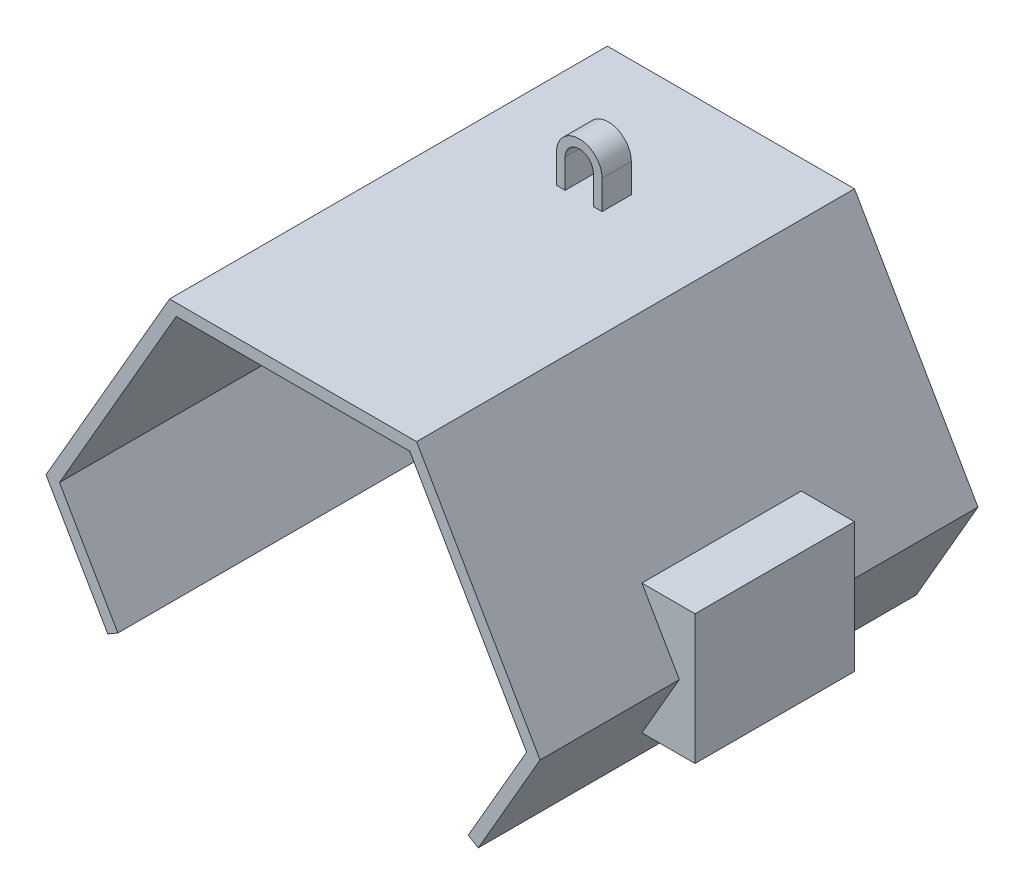
from build123d import *

# Parameters (mm, degrees)
BOSS_EXTRUDE1_DEPTH = 150
BOSS_EXTRUDE2_REACH = 243.582
SKETCH2_W           = 54.603647952
SKETCH2_H           = 44.432380196
BOSS_EXTRUDE3_REACH = 243.582
SKETCH2_3_W         = 54.603647952
SKETCH2_3_H         = 44.432380196
MIRROR1_START       = 47.698176024
MIRROR1_DEPTH       = 54.603647952
CUT_EXTRUDE1_DEPTH  = 194.302477267
CUT_EXTRUDE2_DEPTH  = 54.603647952
BOSS_EXTRUDE4_START = -100
BOSS_EXTRUDE4_DEPTH = 10


# Read off the part's stored shape, not the designer's step: Mirror1
with BuildPart() as part:
    # Sketch1 → Boss-Extrude1 (new body)
    with BuildSketch(Plane.XY):
        Polygon((-42.309401077, 73.282032303), (-84.618802154, 0), (-63.464101615, -36.641016151), (-60, -34.641016151), (-80, 0), (-40, 69.282032303), (40, 69.282032303), (80, 0), (60, -34.641016151), (63.464101615, -36.641016151), (84.618802154, 0), (42.309401077, 73.282032303), align=None)
    extrude(amount=BOSS_EXTRUDE1_DEPTH)

    # Boss-Extrude2: up to this face of the body (flat: up to its plane)
    boss_extrude2_end = Plane(part.part.faces().sort_by_distance((74.041451884, -18.320508076, 75))[0])
    # Sketch2 → Boss-Extrude2 (add, up to the picked face)
    with BuildSketch(Plane(origin=(90, 0, 0), x_dir=(0, 0, -1), z_dir=(1, 0, 0)), mode=Mode.PRIVATE) as boss_extrude2_sk1:
        with Locations((-75, 0)):
            Rectangle(SKETCH2_W, SKETCH2_H)
    boss_extrude2_tool1 = split(extrude(boss_extrude2_sk1.sketch, amount=-BOSS_EXTRUDE2_REACH, mode=Mode.PRIVATE), bisect_by=boss_extrude2_end, keep=Keep.BOTH, mode=Mode.PRIVATE)
    add(boss_extrude2_tool1.solids().sort_by(Axis((90, 0, 75), (-1, 0, 0)))[0])

    # Boss-Extrude3: up to this face of the body (flat: up to its plane)
    boss_extrude3_end = Plane(part.part.faces().sort_by_distance((63.464101615, 36.641016151, 75))[0])
    # Sketch2<3> → Boss-Extrude3 (add, up to the picked face)
    with BuildSketch(Plane(origin=(90, 0, 0), x_dir=(0, 0, -1), z_dir=(1, 0, 0)), mode=Mode.PRIVATE) as boss_extrude3_sk1:
        with Locations((-75, 0)):
            Rectangle(SKETCH2_3_W, SKETCH2_3_H)
    boss_extrude3_tool1 = split(extrude(boss_extrude3_sk1.sketch, amount=-BOSS_EXTRUDE3_REACH, mode=Mode.PRIVATE), bisect_by=boss_extrude3_end, keep=Keep.BOTH, mode=Mode.PRIVATE)
    add(boss_extrude3_tool1.solids().sort_by(Axis((90, 0, 75), (-1, 0, 0)))[0])

    # Mirror1 outline → Mirror1 (add)
    with BuildSketch(Plane.XY.offset(MIRROR1_START)):
        Polygon((97.445325487, -22.216190098), (90, -9.320508076), (90, -22.216190098), align=None)
        Polygon((-67.173476666, -22.216190098), (67.173476666, -22.216190098), (80, 0), (67.173476666, 22.216190098), (-67.173476666, 22.216190098), (-80, 0), align=None)
        Polygon((-90, -22.216190098), (-71.79227882, -22.216190098), (-84.618802154, 0), (-71.79227882, 22.216190098), (-90, 22.216190098), align=None)
    extrude(amount=MIRROR1_DEPTH)

    # Sketch3 → Cut-Extrude1 (cut, through all)
    with BuildSketch(Plane.XY.offset(150)):
        Polygon((80, 0), (60, -34.641016151), (-60, -34.641016151), (-80, 0), (-40, 69.282032303), (40, 69.282032303), align=None)
    extrude(amount=-CUT_EXTRUDE1_DEPTH, mode=Mode.SUBTRACT)

    # Sketch4 → Cut-Extrude2 (cut)
    with BuildSketch(Plane.XY.offset(102.301823976)):
        Polygon((90, -9.320508076), (90, -22.216190098), (97.445325487, -22.216190098), align=None)
    extrude(amount=-CUT_EXTRUDE2_DEPTH, mode=Mode.SUBTRACT)

    # Sketch5 → Boss-Extrude4 (add)
    with BuildSketch(Plane.XY.offset(150).offset(BOSS_EXTRUDE4_START)):
        with BuildLine():
            Line((-9.78911305, 73.282032303), (-9.78911305, 83.156762189))
            ThreePointArc((-9.78911305, 83.156762189), (-1.963791345, 90.982083893), (5.861530359, 83.156762189))
            Line((5.861530359, 83.156762189), (5.861530359, 73.282032303))
            Line((5.861530359, 73.282032303), (2.861530359, 73.282032303))
            Line((2.861530359, 73.282032303), (2.861530359, 83.156762189))
            ThreePointArc((2.861530359, 83.156762189), (-1.963791345, 87.982083893), (-6.78911305, 83.156762189))
            Line((-6.78911305, 83.156762189), (-6.78911305, 73.282032303))
            Line((-6.78911305, 73.282032303), (-9.78911305, 73.282032303))
        make_face()
    extrude(amount=-BOSS_EXTRUDE4_DEPTH)


solid = part.part
